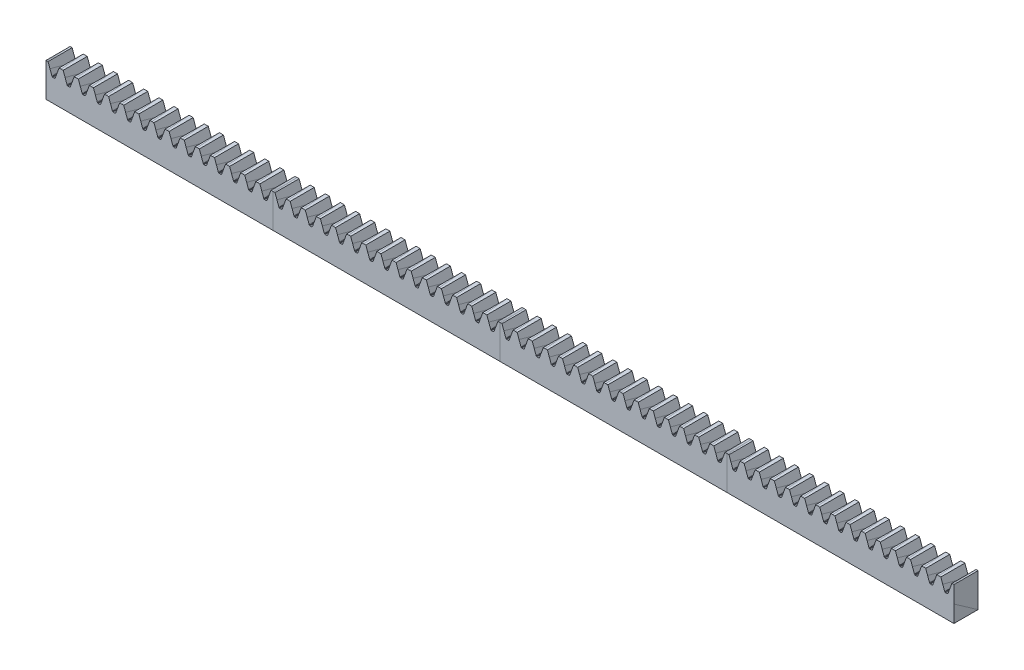
from build123d import *

# Parameters (mm, degrees)
BODY_MOVE_COPY1_DEPTH   = 9.999999776
CUT_EXTRUDE1_DEPTH      = 171.890180259
CUT_EXTRUDE1_DEPTH_BACK = 171.890180259
SKETCH1_W               = 4.999999776
SKETCH1_H               = 7.006254979


with BuildPart() as part:
    # Body-Move/Copy1: read off the stored shape, not the designer's step
    # Body-Move/Copy1 outline → Body-Move/Copy1 (new body)
    with BuildSketch(Plane.XY):
        Polygon((3.857838456, 24.881765712), (3.83942062, 24.842270883), (3.814425785, 24.806573987), (3.783612046, 24.775759783), (3.747914452, 24.750764482), (3.708418924, 24.732347578), (3.666326869, 24.721068796), (3.622914199, 24.717270862), (3.38334078, 24.717270862), (3.339928109, 24.721068796), (3.297836054, 24.732347578), (3.258340526, 24.750764482), (3.222642932, 24.775759783), (3.191829193, 24.806573987), (3.166834358, 24.842270883), (3.148416523, 24.881765712), (2.353759948, 27.065070812), (1.510903705, 27.065070812), (0.716245268, 24.881765712), (0.697829295, 24.842270883), (0.672830734, 24.806573987), (0.642018858, 24.775759783), (0.606321264, 24.750764482), (0.566827599, 24.732347578), (0.524733681, 24.721068796), (0.481322873, 24.717270862), (0.241747592, 24.717270862), (0.198334921, 24.721068796), (0.156242866, 24.732347578), (0.116747338, 24.750764482), (0.081051607, 24.775759783), (0.050236005, 24.806573987), (0.02524117, 24.842270883), (0.006825197, 24.881765712), (-0.78783324, 27.065070812), (-1.630687621, 27.065070812), (-2.425347921, 24.881765712), (-2.443763893, 24.842270883), (-2.468758728, 24.806573987), (-2.49957433, 24.775759783), (-2.535270061, 24.750764482), (-2.574765589, 24.732347578), (-2.616857644, 24.721068796), (-2.660270315, 24.717270862), (-2.899845596, 24.717270862), (-2.943256404, 24.721068796), (-2.985350322, 24.732347578), (-3.02484585, 24.750764482), (-3.060541581, 24.775759783), (-3.09135532, 24.806573987), (-3.116352018, 24.842270883), (-3.134767991, 24.881765712), (-3.929426428, 27.065070812), (-4.772282671, 27.065070812), (-5.566939246, 24.881765712), (-5.582682323, 24.847023655), (-5.603525322, 24.815080687), (-5.628985818, 24.786680005), (-5.658469629, 24.762482848), (-5.691291299, 24.743052665), (-5.726687144, 24.728841614), (-5.763833877, 24.720180547), (-5.80186164, 24.717270862), (-6.041438784, 24.717270862), (-6.079470273, 24.720180547), (-6.116615143, 24.728841614), (-6.152009126, 24.743052665), (-6.184832659, 24.762482848), (-6.214314606, 24.786680005), (-6.239777897, 24.815080687), (-6.260619964, 24.847023655), (-6.276359316, 24.881765712), (-7.071019616, 27.065070812), (-7.913873997, 27.065070812), (-8.708534297, 24.881765712), (-8.724273648, 24.847023655), (-8.745116647, 24.815080687), (-8.770579007, 24.786680005), (-8.800060954, 24.762482848), (-8.832884487, 24.743052665), (-8.86827847, 24.728841614), (-8.905423339, 24.720180547), (-8.943454828, 24.717270862), (-9.183031973, 24.717270862), (-9.221059736, 24.720180547), (-9.258208331, 24.728841614), (-9.293602314, 24.743052665), (-9.326425847, 24.762482848), (-9.355908725, 24.786680005), (-9.381370153, 24.815080687), (-9.402213153, 24.847023655), (-9.417952504, 24.881765712), (-10.212612804, 27.065070812), (-11.055467185, 27.065070812), (-11.850122828, 24.881765712), (-11.865866836, 24.847023655), (-11.886709835, 24.815080687), (-11.912168469, 24.786680005), (-11.941654142, 24.762482848), (-11.974477675, 24.743052665), (-12.009871658, 24.728841614), (-12.047016528, 24.720180547), (-12.085048016, 24.717270862), (-12.324621435, 24.717270862), (-12.362652924, 24.720180547), (-12.399797793, 24.728841614), (-12.435195502, 24.743052665), (-12.468015775, 24.762482848), (-12.497500982, 24.786680005), (-12.522959616, 24.815080687), (-12.543806341, 24.847023655), (-12.559545692, 24.881765712), (-13.354205992, 27.065070812), (-14.197060373, 27.065070812), (-14.991716947, 24.881765712), (-15.007460024, 24.847023655), (-15.028303023, 24.815080687), (-15.053761657, 24.786680005), (-15.08324733, 24.762482848), (-15.116070397, 24.743052665), (-15.151464846, 24.728841614), (-15.188610181, 24.720180547), (-15.226641204, 24.717270862), (-15.466214623, 24.717270862), (-15.504246112, 24.720180547), (-15.541390982, 24.728841614), (-15.57678869, 24.743052665), (-15.609608497, 24.762482848), (-15.63909417, 24.786680005), (-15.664552338, 24.815080687), (-15.685395803, 24.847023655), (-15.70113888, 24.881765712), (-16.495795455, 27.065070812), (-17.338653328, 27.065070812), (-18.133310252, 24.881765712), (-18.149053212, 24.847023655), (-18.169896211, 24.815080687), (-18.195354845, 24.786680005), (-18.224840518, 24.762482848), (-18.257660209, 24.743052665), (-18.293058034, 24.728841614), (-18.330202904, 24.720180547), (-18.368234392, 24.717270862), (-18.607807695, 24.717270862), (-18.6458393, 24.720180547), (-18.682984286, 24.728841614), (-18.718381878, 24.743052665), (-18.751201802, 24.762482848), (-18.780687358, 24.786680005), (-18.806145992, 24.815080687), (-18.826989108, 24.847023655), (-18.842732068, 24.881765712), (-19.637388643, 27.065070812), (-20.058815833, 27.065070812), (-20.058815833, 20.058815833), (27.065070812, 20.058815833), (27.065070812, 27.065070812), (26.643643621, 27.065070812), (25.848987047, 24.881765712), (25.830569211, 24.842270883), (25.805572513, 24.806573987), (25.774760637, 24.775759783), (25.739064906, 24.750764482), (25.699569378, 24.732347578), (25.657473598, 24.721068796), (25.61406279, 24.717270862), (25.374489371, 24.717270862), (25.331078563, 24.721068796), (25.288982783, 24.732347578), (25.249487255, 24.750764482), (25.213791523, 24.775759783), (25.182979647, 24.806573987), (25.157979224, 24.842270883), (25.139565114, 24.881765712), (24.344908539, 27.065070812), (23.502050433, 27.065070812), (22.707393859, 24.881765712), (22.688976023, 24.842270883), (22.663983051, 24.806573987), (22.633167449, 24.775759783), (22.597471718, 24.750764482), (22.55797619, 24.732347578), (22.515884135, 24.721068796), (22.472469602, 24.717270862), (22.232896183, 24.717270862), (22.189485375, 24.721068796), (22.147389594, 24.732347578), (22.107897792, 24.750764482), (22.072198335, 24.775759783), (22.041386459, 24.806573987), (22.016389761, 24.842270883), (21.997971926, 24.881765712), (21.203315351, 27.065070812), (20.360457245, 27.065070812), (19.565800671, 24.881765712), (19.547382835, 24.842270883), (19.522389863, 24.806573987), (19.491574261, 24.775759783), (19.45587853, 24.750764482), (19.416383002, 24.732347578), (19.374290947, 24.721068796), (19.330876414, 24.717270862), (19.091302995, 24.717270862), (19.047892187, 24.721068796), (19.005800132, 24.732347578), (18.966304604, 24.750764482), (18.930605147, 24.775759783), (18.899793271, 24.806573987), (18.874796573, 24.842270883), (18.856378738, 24.881765712), (18.061722163, 27.065070812), (17.218867782, 27.065070812), (16.424207482, 24.881765712), (16.405793373, 24.842270883), (16.380796675, 24.806573987), (16.349981073, 24.775759783), (16.314285342, 24.750764482), (16.274789814, 24.732347578), (16.232697759, 24.721068796), (16.189286951, 24.717270862), (15.949709807, 24.717270862), (15.906298999, 24.721068796), (15.864206944, 24.732347578), (15.824711416, 24.750764482), (15.789011959, 24.775759783), (15.758200083, 24.806573987), (15.733203385, 24.842270883), (15.714789275, 24.881765712), (14.9201327, 27.065070812), (14.077274594, 27.065070812), (13.282614294, 24.881765712), (13.264200184, 24.842270883), (13.239203487, 24.806573987), (13.208391611, 24.775759783), (13.172692154, 24.750764482), (13.133196626, 24.732347578), (13.091104571, 24.721068796), (13.047693763, 24.717270862), (12.808116619, 24.717270862), (12.764705811, 24.721068796), (12.722613756, 24.732347578), (12.683118228, 24.750764482), (12.647422496, 24.775759783), (12.616606895, 24.806573987), (12.591610197, 24.842270883), (12.573196087, 24.881765712), (11.778535787, 27.065070812), (10.935681406, 27.065070812), (10.141022969, 24.881765712), (10.122606996, 24.842270883), (10.097610299, 24.806573987), (10.06679656, 24.775759783), (10.031098966, 24.750764482), (9.9916053, 24.732347578), (9.949511383, 24.721068796), (9.906100575, 24.717270862), (9.666525293, 24.717270862), (9.623114485, 24.721068796), (9.581020568, 24.732347578), (9.54152504, 24.750764482), (9.505829308, 24.775759783), (9.475013707, 24.806573987), (9.450018872, 24.842270883), (9.431602899, 24.881765712), (8.636944462, 27.065070812), (7.794088218, 27.065070812), (6.999429781, 24.881765712), (6.981013808, 24.842270883), (6.956018973, 24.806573987), (6.925203372, 24.775759783), (6.88950764, 24.750764482), (6.850012112, 24.732347578), (6.807920057, 24.721068796), (6.764507387, 24.717270862), (6.524932105, 24.717270862), (6.481521297, 24.721068796), (6.43942738, 24.732347578), (6.399933714, 24.750764482), (6.36423612, 24.775759783), (6.333422381, 24.806573987), (6.308427546, 24.842270883), (6.290009711, 24.881765712), (5.495351274, 27.065070812), (4.65249503, 27.065070812), align=None)
    extrude(amount=BODY_MOVE_COPY1_DEPTH)


with BuildPart() as body_2:
    # Body-Move/Copy4: copy of part
    add(part.part.moved(Location((47.12389, 0, 0))))


with BuildPart() as body_3:
    # Body-Move/Copy5: copy of body 2
    add(body_2.part.moved(Location((47.12389, 0, 0))))


with BuildPart() as body_4:
    # Body-Move/Copy6: copy of body 3
    add(body_3.part.moved(Location((47.12389, 0, 0))))


with BuildPart() as cut_extrude1_tool:
    # Sketch1 → Cut-Extrude1 (new, two sides: drawn at the far end of the back side and taken through both)
    with BuildSketch(Plane(origin=(0, 0, 0), x_dir=(0, 0, -1), z_dir=(1, 0, 0)).offset(-CUT_EXTRUDE1_DEPTH_BACK)):
        with Locations((-7.499999888, 23.561943322)):
            Rectangle(SKETCH1_W, SKETCH1_H)
    extrude(amount=CUT_EXTRUDE1_DEPTH + CUT_EXTRUDE1_DEPTH_BACK)


with BuildPart() as part_1:
    add(part.part)

    # Cut-Extrude1: cut by cut_extrude1_tool
    add(cut_extrude1_tool.part, mode=Mode.SUBTRACT)


with BuildPart() as body_2_1:
    add(body_2.part)

    # Cut-Extrude1: cut by cut_extrude1_tool
    add(cut_extrude1_tool.part, mode=Mode.SUBTRACT)


with BuildPart() as body_3_1:
    add(body_3.part)

    # Cut-Extrude1: cut by cut_extrude1_tool
    add(cut_extrude1_tool.part, mode=Mode.SUBTRACT)


with BuildPart() as body_4_1:
    add(body_4.part)

    # Cut-Extrude1: cut by cut_extrude1_tool
    add(cut_extrude1_tool.part, mode=Mode.SUBTRACT)


solid = Compound([part_1.part, body_2_1.part, body_3_1.part, body_4_1.part])
